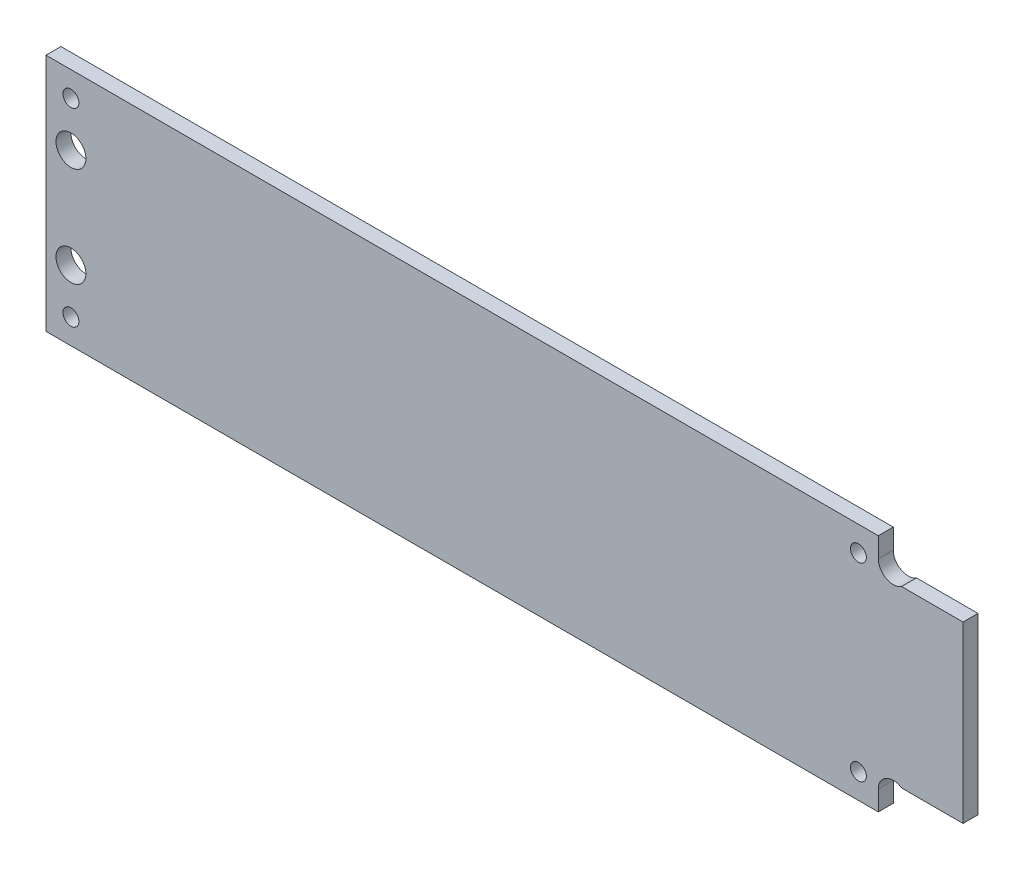
from build123d import *

# Parameters (mm, degrees)
SKETCH1_R           = 3
BOSS_EXTRUDE1_DEPTH = 3
BOSS_EXTRUDE2_DEPTH = 2
CHAMFER1_SIZE       = 0.5
FILLET1_R           = 1
SKETCH3_R           = 1.6
CUT_EXTRUDE1_DEPTH  = 103.961157725


with BuildPart() as part:
    # Sketch1 → Boss-Extrude1 (new body)
    with BuildSketch(Plane.XY):
        with BuildLine():
            Line((87.658312395, -17.5), (100, -17.5))
            Line((100, -17.5), (100, 17.5))
            Line((100, 17.5), (87.658312395, 17.5))
            ThreePointArc((87.658312395, 17.5), (84.581362835, 17.356617963), (83, 20))
            Line((83, 20), (83, 24))
            Line((83, 24), (-84, 24))
            Line((-84, 24), (-84, -24))
            Line((-84, -24), (83, -24))
            Line((83, -24), (83, -20))
            ThreePointArc((83, -20), (84.581362835, -17.356617963), (87.658312395, -17.5))
        make_face()
        with Locations((-79, -10)):
            Circle(SKETCH1_R, mode=Mode.SUBTRACT)
        with Locations((-79, 10)):
            Circle(SKETCH1_R, mode=Mode.SUBTRACT)
    extrude(amount=BOSS_EXTRUDE1_DEPTH)

    # Sketch2 → Boss-Extrude2 (add)
    with BuildSketch(Plane(origin=(0, 0, 0), x_dir=(-1, 0, 0), z_dir=(0, 0, -1))):
        with BuildLine():
            Line((-73.5, 20), (-73.5, 9.5))
            Line((-73.5, 9.5), (-77.5, 9.5))
            Line((-77.5, 9.5), (-77.5, 15))
            Line((-77.5, 15), (-97.5, 15))
            Line((-97.5, 15), (-97.5, -15))
            Line((-97.5, -15), (-77.5, -15))
            Line((-77.5, -15), (-77.5, -9.5))
            Line((-77.5, -9.5), (-73.5, -9.5))
            Line((-73.5, -9.5), (-73.5, -20))
            ThreePointArc((-73.5, -20), (-73.353553391, -20.353553391), (-73, -20.5))
            Line((-73, -20.5), (-6, -20.5))
            ThreePointArc((-6, -20.5), (-5.646446609, -20.353553391), (-5.5, -20))
            Line((-5.5, -20), (-5.5, -19))
            ThreePointArc((-5.5, -19), (0, -13.5), (5.5, -19))
            Line((5.5, -19), (5.5, -20))
            ThreePointArc((5.5, -20), (5.646446609, -20.353553391), (6, -20.5))
            Line((6, -20.5), (73, -20.5))
            ThreePointArc((73, -20.5), (73.353553391, -20.353553391), (73.5, -20))
            Line((73.5, -20), (73.5, 20))
            ThreePointArc((73.5, 20), (73.353553391, 20.353553391), (73, 20.5))
            Line((73, 20.5), (6, 20.5))
            ThreePointArc((6, 20.5), (5.646446609, 20.353553391), (5.5, 20))
            Line((5.5, 20), (5.5, 19))
            ThreePointArc((5.5, 19), (0, 13.5), (-5.5, 19))
            Line((-5.5, 19), (-5.5, 20))
            ThreePointArc((-5.5, 20), (-5.646446609, 20.353553391), (-6, 20.5))
            Line((-6, 20.5), (-73, 20.5))
            ThreePointArc((-73, 20.5), (-73.353553391, 20.353553391), (-73.5, 20))
        make_face()
        with BuildLine():
            Line((-7.483314774, 18.5), (-71.5, 18.5))
            Line((-71.5, 18.5), (-71.5, 7.5))
            Line((-71.5, 7.5), (-79.5, 7.5))
            Line((-79.5, 7.5), (-79.5, 13))
            Line((-79.5, 13), (-95.5, 13))
            Line((-95.5, 13), (-95.5, -13))
            Line((-95.5, -13), (-79.5, -13))
            Line((-79.5, -13), (-79.5, -7.5))
            Line((-79.5, -7.5), (-71.5, -7.5))
            Line((-71.5, -7.5), (-71.5, -18.5))
            Line((-71.5, -18.5), (-7.483314774, -18.5))
            ThreePointArc((-7.483314774, -18.5), (0, -11.5), (7.483314774, -18.5))
            Line((7.483314774, -18.5), (71.5, -18.5))
            Line((71.5, -18.5), (71.5, 18.5))
            Line((71.5, 18.5), (7.483314774, 18.5))
            ThreePointArc((7.483314774, 18.5), (0, 11.5), (-7.483314774, 18.5))
        make_face(mode=Mode.SUBTRACT)
    extrude(amount=BOSS_EXTRUDE2_DEPTH)

    # Chamfer1
    chamfer1_edges = [part.edges().sort_by_distance(p)[0] for p in [
        (73.353553391, 20.353553391, -2),
        (73.5, 14.75, -2),
        (75.5, 9.5, -2),
        (77.5, 12.25, -2),
        (87.5, 15, -2),
        (97.5, 0, -2),
        (87.5, -15, -2),
        (77.5, -12.25, -2),
        (75.5, -9.5, -2),
        (73.5, -14.75, -2),
        (73.353553391, -20.353553391, -2),
        (39.5, -20.5, -2),
        (5.646446609, -20.353553391, -2),
        (5.5, -19.5, -2),
        (0, -13.5, -2),
        (-5.5, -19.5, -2),
        (-5.646446609, -20.353553391, -2),
        (-39.5, -20.5, -2),
        (-73.353553391, -20.353553391, -2),
        (-73.5, 0, -2),
        (-73.353553391, 20.353553391, -2),
        (-39.5, 20.5, -2),
        (-5.646446609, 20.353553391, -2),
        (-5.5, 19.5, -2),
        (0, 13.5, -2),
        (5.5, 19.5, -2),
        (5.646446609, 20.353553391, -2),
        (39.5, 20.5, -2),
    ]]
    chamfer(chamfer1_edges, length=CHAMFER1_SIZE - 0.0001)  # a hair under: the kernel refuses the full size

    # Fillet1
    fillet1_edges = [part.edges().sort_by_distance(p)[0] for p in [
        (0, 11.5, 0),
        (39.491657387, 18.5, 0),
        (71.5, 13, 0),
        (75.5, 7.5, 0),
        (79.5, 10.25, 0),
        (87.5, 13, 0),
        (95.5, 0, 0),
        (87.5, -13, 0),
        (79.5, -10.25, 0),
        (75.5, -7.5, 0),
        (71.5, -13, 0),
        (39.491657387, -18.5, 0),
        (0, -11.5, 0),
        (-39.491657387, -18.5, 0),
        (-71.5, 0, 0),
        (-39.491657387, 18.5, 0),
    ]]
    fillet(fillet1_edges, radius=FILLET1_R)

    # Sketch3 → Cut-Extrude1 (cut, through all)
    with BuildSketch(Plane.XY.offset(3)):
        with Locations((-79, 19)):
            Circle(SKETCH3_R)
        with Locations((-79, -19)):
            Circle(SKETCH3_R)
        with Locations((79, 19)):
            Circle(SKETCH3_R)
        with Locations((79, -19)):
            Circle(SKETCH3_R)
    extrude(amount=-CUT_EXTRUDE1_DEPTH, mode=Mode.SUBTRACT)


solid = part.part
